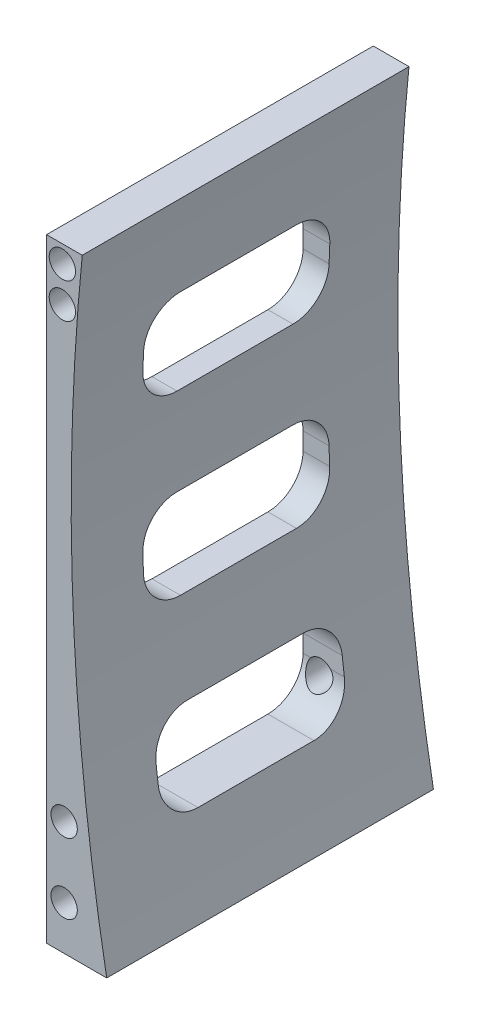
from build123d import *

# Parameters (mm, degrees)
RESSALTO_EXTRUS_O1_DEPTH = 37.2
FILETE3_R                = 10
FILETE4_R                = 10
ESBO_O3_W                = 64.493903811
ESBO_O3_H                = 22.028162523
CORTE_EXTRUS_O2_DEPTH    = 126.622328301
ESBO_O4_W                = 56.697594262
ESBO_O4_H                = 123.119514717
CORTE_EXTRUS_O6_DEPTH    = 126.622328159
ESBO_O7_W                = 25.761955102
ESBO_O7_H                = 34.830585193
CORTE_EXTRUS_O7_DEPTH    = 125.245881598
CORTE_EXTRUS_O8_DEPTH    = 90.772656751
ESBO_O9_R                = 1.5
CORTE_EXTRUS_O9_DEPTH    = 92.227960203


with BuildPart() as part:
    # Esboço1 → Ressalto-extrusão1 (new body)
    with BuildSketch(Plane.XY):
        with BuildLine():
            ThreePointArc((-10, 0), (0, -10), (10, 0))
            Line((10, 0), (20, 0))
            ThreePointArc((20, 0), (14.071698091, 40.495175194), (14.829943665, 81.414963086))
            ThreePointArc((14.829943665, 81.414963086), (11.193742071, 116.066691762), (-16.576524471, 95.024435265))
            Line((-16.576524471, 95.024435265), (-16.487894969, 94.437265709))
            Line((-16.487894969, 94.437265709), (-16.369382775, 93.652123615))
            ThreePointArc((-16.369382775, 93.652123615), (-13.756795166, 46.654405302), (-20, 0))
            Line((-20, 0), (-10, 0))
        make_face()
    extrude(amount=RESSALTO_EXTRUS_O1_DEPTH)

    # Filete3
    # the kernel refuses this fillet: 10 mm, written as the material it takes off along each edge
    with BuildSketch(Plane(origin=(20, 0, -29.463728433), x_dir=(-0.20232831186330175, 0.9793177493635794, 0), z_dir=(0, 0, 1))) as filete3_piece_1:
        with BuildLine():
            CenterArc((12.021201201, 9.997221658), FILETE3_R, 181.169168083, 87.480189)
            Line((2.023283119, 9.793177494), (1.823324757, 9.78909661))
            ThreePointArc((1.823324757, 9.78909661), (0.815778009, 4.937054409), (-0.19586355, 0.040465662))
            Line((-0.19586355, 0.040465662), (0.004714197, -0.199944433))
            ThreePointArc((0.004714197, -0.199944433), (5.892745687, -0.130541448), (11.780777177, -0.199944433))
            Line((11.780777177, -0.199944433), (11.785491373, 0))
        make_face()
    extrude(amount=96.127456867, mode=Mode.SUBTRACT)
    with BuildSketch(Plane(origin=(-20, 0, -29.463728433), x_dir=(1, 0, 0), z_dir=(0, 0, 1))) as filete3_piece_2:
        with BuildLine():
            CenterArc((12.222685959, 9.749854723), FILETE3_R, 169.67749742, 87.480189)
            Line((2.384538574, 11.541740887), (2.187775626, 11.57757861))
            ThreePointArc((2.187775626, 11.57757861), (1.06442773, 5.797282674), (-0.194855317, 0.045071116))
            Line((-0.194855317, 0.045071116), (0, -0.2))
            ThreePointArc((0, -0.2), (5, -0.2), (9.955546281, -0.194997094))
            Line((9.955546281, -0.194997094), (10, 0))
        make_face()
    extrude(amount=96.127456867, mode=Mode.SUBTRACT)

    # Filete4
    filete4_edges = [part.edges().sort_by_distance(p)[0] for p in [
        (10, 0, 18.6),
        (-10, 0, 18.6),
    ]]
    fillet(filete4_edges, radius=FILETE4_R)

    # Esboço3 → Corte-extrusão2 (cut, through all)
    with BuildSketch(Plane.XY.offset(37.2)):
        with Locations((-2.119172362, 0.527659626)):
            Rectangle(ESBO_O3_W, ESBO_O3_H)
    extrude(amount=-CORTE_EXTRUS_O2_DEPTH, mode=Mode.SUBTRACT)

    # Esboço4 → Corte-extrusão6 (cut, through all)
    with BuildSketch(Plane.XY.offset(37.2)):
        with Locations((-17.581232159, 73.101498246)):
            Rectangle(ESBO_O4_W, ESBO_O4_H)
    extrude(amount=-CORTE_EXTRUS_O6_DEPTH, mode=Mode.SUBTRACT)

    # Esboço7 → Corte-extrusão7 (cut, through all)
    with BuildSketch(Plane.XY.offset(37.2)):
        with Locations((23.648542523, 98.830255682)):
            Rectangle(ESBO_O7_W, ESBO_O7_H)
    extrude(amount=-CORTE_EXTRUS_O7_DEPTH, mode=Mode.SUBTRACT)

    # Esboço8 → Corte-extrusão8 (cut, through all)
    with BuildSketch(Plane.ZY.offset(-10.767564972)):
        with BuildLine():
            Line((12, 71.414963086), (25.2, 71.414963086))
            ThreePointArc((25.2, 71.414963086), (28.028427125, 70.243390211), (29.2, 67.414963086))
            Line((29.2, 67.414963086), (29.2, 65.414963086))
            ThreePointArc((29.2, 65.414963086), (28.028427125, 62.586535961), (25.2, 61.414963086))
            Line((25.2, 61.414963086), (12, 61.414963086))
            ThreePointArc((12, 61.414963086), (9.171572875, 62.586535961), (8, 65.414963086))
            Line((8, 65.414963086), (8, 67.414963086))
            ThreePointArc((8, 67.414963086), (9.171572875, 70.243390211), (12, 71.414963086))
        make_face()
        with BuildLine():
            Line((12, 51.474963086), (25.2, 51.474963086))
            ThreePointArc((25.2, 51.474963086), (28.028427125, 50.303390211), (29.2, 47.474963086))
            Line((29.2, 47.474963086), (29.2, 45.474963086))
            ThreePointArc((29.2, 45.474963086), (28.028427125, 42.646535961), (25.2, 41.474963086))
            Line((25.2, 41.474963086), (12, 41.474963086))
            ThreePointArc((12, 41.474963086), (9.171572875, 42.646535961), (8, 45.474963086))
            Line((8, 45.474963086), (8, 47.474963086))
            ThreePointArc((8, 47.474963086), (9.171572875, 50.303390211), (12, 51.474963086))
        make_face()
        with BuildLine():
            Line((12, 31.541740887), (25.2, 31.541740887))
            ThreePointArc((25.2, 31.541740887), (28.028427125, 30.370168012), (29.2, 27.541740887))
            Line((29.2, 27.541740887), (29.2, 25.541740887))
            ThreePointArc((29.2, 25.541740887), (28.028427125, 22.713313762), (25.2, 21.541740887))
            Line((25.2, 21.541740887), (12, 21.541740887))
            ThreePointArc((12, 21.541740887), (9.171572875, 22.713313762), (8, 25.541740887))
            Line((8, 25.541740887), (8, 27.541740887))
            ThreePointArc((8, 27.541740887), (9.171572875, 30.370168012), (12, 31.541740887))
        make_face()
    extrude(amount=-CORTE_EXTRUS_O8_DEPTH, mode=Mode.SUBTRACT)

    # Esboço9 → Corte-extrusão9 (cut, through all)
    with BuildSketch(Plane(origin=(0, 0, 0), x_dir=(-1, 0, 0), z_dir=(0, 0, -1))):
        with Locations((-12.767564972, 16.541740887)):
            Circle(ESBO_O9_R)
        with Locations((-12.767564972, 24.541740887)):
            Circle(ESBO_O9_R)
        with Locations((-12.567564972, 79.414963086)):
            Circle(ESBO_O9_R)
        with Locations((-12.567564972, 75.414963086)):
            Circle(ESBO_O9_R)
    extrude(amount=-CORTE_EXTRUS_O9_DEPTH, mode=Mode.SUBTRACT)


solid = part.part
